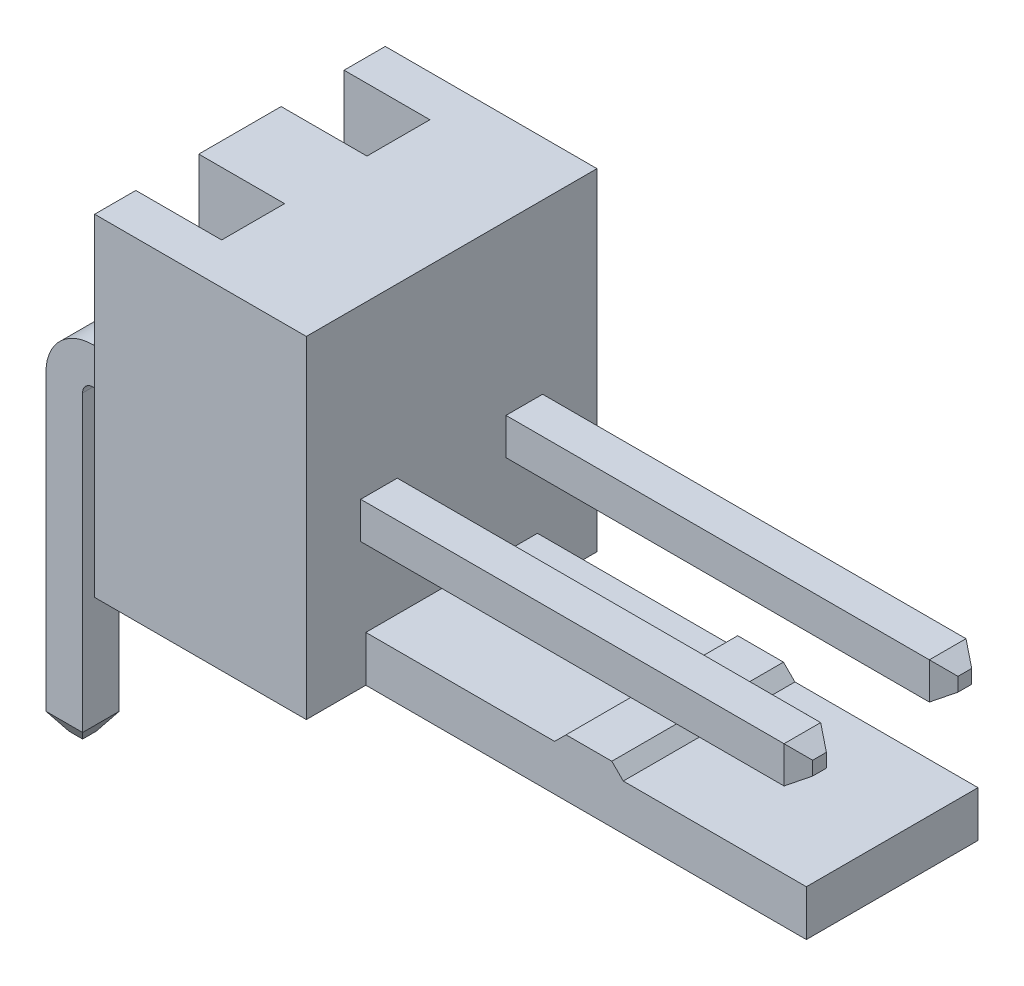
from build123d import *
from OCP.BRepFilletAPI import BRepFilletAPI_MakeChamfer

# Parameters (mm, degrees)
SKETCH_1_W                           = 5.08
SKETCH_1_H                           = 5.8
EXTRUDE_1_DEPTH                      = 3.7
CUT_EXTRUDE_1_REACH                  = 9.334
SKETCH_5_W                           = 1.5
SKETCH_5_H                           = 1.1
EXTRUDE_START                        = 1.27
EXTRUDE_1_2_DEPTH                    = 0.32
CHAMFER_1_SIZE                       = 0.2
CHAMFER_1_SIZE2                      = 0.3
CHAMFER_2_SIZE                       = 0.3
CHAMFER_2_SIZE_2                     = 0.2
EXTRUDE_2_DEPTH                      = 1.5
PATTERN_LINEAR_2_COUNT               = 2
PATTERN_LINEAR_2_PITCH               = 2.54
CHAMFER_1_OF_PATTERN_LINEAR_2_SIZE2  = 0.2
CHAMFER_1_OF_PATTERN_LINEAR_2_SIZE   = 0.3
CHAMFER_2_OF_PATTERN_LINEAR_2_SIZE   = 0.3
CHAMFER_2_OF_PATTERN_LINEAR_2_SIZE_2 = 0.2


with BuildPart() as part:
    # Эскиз1 → Extrude 1 (new body)
    with BuildSketch(Plane(origin=(0, 0, 0), x_dir=(0, 0, -1), z_dir=(1, 0, 0))):
        with Locations((0, 2.9)):
            Rectangle(SKETCH_1_W, SKETCH_1_H)
    extrude(amount=EXTRUDE_1_DEPTH)

    # Эскиз5 → Вырез-Вытянуть1 (cut, up to next)
    with BuildSketch(Plane(origin=(0, 5.8, 0), x_dir=(1, 0, 0), z_dir=(0, 1, 0)), mode=Mode.PRIVATE) as cut_extrude_1_sk1:
        with Locations((0.75, -1.27)):
            Rectangle(SKETCH_5_W, SKETCH_5_H)
    cut_extrude_1_tool1 = extrude(cut_extrude_1_sk1.sketch, amount=-CUT_EXTRUDE_1_REACH, mode=Mode.PRIVATE) & part.part
    cut_extrude_1 = cut_extrude_1_tool1.solids().sort_by_distance((0.75, 5.8, 1.27))[0]
    add(cut_extrude_1, mode=Mode.SUBTRACT)

    # Эскиз3 → Extrude 1 2 (add, symmetric)
    with BuildSketch(Plane.XY.offset(EXTRUDE_START)):
        with BuildLine():
            Line((-1.16, -3.4), (-1.16, 2.04))
            ThreePointArc((-1.16, 2.04), (-1.107279221, 2.167279221), (-0.98, 2.22))
            Line((-0.98, 2.22), (11.4, 2.22))
            Line((11.4, 2.22), (11.4, 2.86))
            Line((11.4, 2.86), (-0.98, 2.86))
            ThreePointArc((-0.98, 2.86), (-1.559827561, 2.619827561), (-1.8, 2.04))
            Line((-1.8, 2.04), (-1.8, -3.4))
            Line((-1.8, -3.4), (-1.16, -3.4))
        make_face()
    extrude_1_2 = extrude(amount=EXTRUDE_1_2_DEPTH, both=True)

    # Фаска1
    chamfer_1_edges = [part.edges().sort_by_distance(p)[0] for p in [
        (11.4, 2.54, 1.59),
        (11.4, 2.22, 1.27),
        (11.4, 2.86, 1.27),
        (11.4, 2.54, 0.95),
    ]]
    chamfer_1_side = [part.faces().sort_by_distance(p)[0] for p in [
        (11.4, 2.54, 1.27),
    ]]
    chamfer(chamfer_1_edges, length=CHAMFER_1_SIZE, length2=CHAMFER_1_SIZE2, reference=chamfer_1_side[0])

    # Фаска2
    chamfer_2_edges_1 = [part.edges().sort_by_distance(p)[0] for p in [
        (-1.48, -3.4, 0.95),
    ]]
    chamfer_2_side_1 = [part.faces().sort_by_distance(p)[0] for p in [
        (-1.48, -3.396, 0.95),
    ]]
    chamfer_2_edges_2 = [part.edges().sort_by_distance(p)[0] for p in [
        (-1.48, -3.4, 1.59),
    ]]
    chamfer_2_side_2 = [part.faces().sort_by_distance(p)[0] for p in [
        (-1.48, -3.396, 1.59),
    ]]
    chamfer_2_edges_3 = [part.edges().sort_by_distance(p)[0] for p in [
        (-1.8, -3.4, 1.27),
    ]]
    chamfer_2_side_3 = [part.faces().sort_by_distance(p)[0] for p in [
        (-1.796, -3.4, 1.27),
    ]]
    chamfer_2_edges_4 = [part.edges().sort_by_distance(p)[0] for p in [
        (-1.16, -3.4, 1.27),
    ]]
    chamfer_2_side_4 = [part.faces().sort_by_distance(p)[0] for p in [
        (-1.16, -3.396, 1.27),
    ]]
    chamfer_2 = BRepFilletAPI_MakeChamfer(part.part.solid().wrapped)
    for e in chamfer_2_edges_1:
        chamfer_2.Add(CHAMFER_2_SIZE - 0.0001, CHAMFER_2_SIZE_2 - 0.0001, e.wrapped, chamfer_2_side_1[0].wrapped)
    for e in chamfer_2_edges_2:
        chamfer_2.Add(CHAMFER_2_SIZE - 0.0001, CHAMFER_2_SIZE_2 - 0.0001, e.wrapped, chamfer_2_side_2[0].wrapped)
    for e in chamfer_2_edges_3:
        chamfer_2.Add(CHAMFER_2_SIZE_2 - 0.0001, CHAMFER_2_SIZE - 0.0001, e.wrapped, chamfer_2_side_3[0].wrapped)
    for e in chamfer_2_edges_4:
        chamfer_2.Add(CHAMFER_2_SIZE - 0.0001, CHAMFER_2_SIZE_2 - 0.0001, e.wrapped, chamfer_2_side_4[0].wrapped)
    add(Compound.cast(chamfer_2.Shape()), mode=Mode.REPLACE)  # a hair under: the kernel refuses the full size

    # Эскиз4 → Бобышка-Вытянуть2 (add, symmetric)
    with BuildSketch(Plane.XY):
        Polygon((3.7, 0), (3.7, 0.8), (7, 0.8), (7.2, 1), (8, 1), (8.2, 0.8), (11.4, 0.8), (11.4, 0), align=None)
    extrude(amount=EXTRUDE_2_DEPTH, both=True)

    # Линейный массив2: Вырез-Вытянуть1, Extrude 1 2 ×2
    with Locations(*[(0, 0, -i * PATTERN_LINEAR_2_PITCH) for i in range(1, PATTERN_LINEAR_2_COUNT)]):
        add(cut_extrude_1, mode=Mode.SUBTRACT)
        add(extrude_1_2)

    # Фаска1 of Линейный массив2
    chamfer_1_of_pattern_linear_2_edges = [part.edges().sort_by_distance(p)[0] for p in [
        (11.4, 2.54, -0.95),
        (11.4, 2.22, -1.27),
        (11.4, 2.86, -1.27),
        (11.4, 2.54, -1.59),
    ]]
    chamfer(chamfer_1_of_pattern_linear_2_edges, length=CHAMFER_1_OF_PATTERN_LINEAR_2_SIZE, length2=CHAMFER_1_OF_PATTERN_LINEAR_2_SIZE2)

    # Фаска2 of Линейный массив2
    chamfer_2_of_pattern_linear_2_edges_1 = [part.edges().sort_by_distance(p)[0] for p in [
        (-1.48, -3.4, -1.59),
    ]]
    chamfer_2_of_pattern_linear_2_side_1 = [part.faces().sort_by_distance(p)[0] for p in [
        (-1.48, -3.396, -1.59),
    ]]
    chamfer_2_of_pattern_linear_2_edges_2 = [part.edges().sort_by_distance(p)[0] for p in [
        (-1.48, -3.4, -0.95),
    ]]
    chamfer_2_of_pattern_linear_2_side_2 = [part.faces().sort_by_distance(p)[0] for p in [
        (-1.48, -3.396, -0.95),
    ]]
    chamfer_2_of_pattern_linear_2_edges_3 = [part.edges().sort_by_distance(p)[0] for p in [
        (-1.8, -3.4, -1.27),
    ]]
    chamfer_2_of_pattern_linear_2_side_3 = [part.faces().sort_by_distance(p)[0] for p in [
        (-1.796, -3.4, -1.27),
    ]]
    chamfer_2_of_pattern_linear_2_edges_4 = [part.edges().sort_by_distance(p)[0] for p in [
        (-1.16, -3.4, -1.27),
    ]]
    chamfer_2_of_pattern_linear_2_side_4 = [part.faces().sort_by_distance(p)[0] for p in [
        (-1.16, -3.396, -1.27),
    ]]
    chamfer_2_of_pattern_linear_2 = BRepFilletAPI_MakeChamfer(part.part.solid().wrapped)
    for e in chamfer_2_of_pattern_linear_2_edges_1:
        chamfer_2_of_pattern_linear_2.Add(CHAMFER_2_OF_PATTERN_LINEAR_2_SIZE - 0.0001, CHAMFER_2_OF_PATTERN_LINEAR_2_SIZE_2 - 0.0001, e.wrapped, chamfer_2_of_pattern_linear_2_side_1[0].wrapped)
    for e in chamfer_2_of_pattern_linear_2_edges_2:
        chamfer_2_of_pattern_linear_2.Add(CHAMFER_2_OF_PATTERN_LINEAR_2_SIZE - 0.0001, CHAMFER_2_OF_PATTERN_LINEAR_2_SIZE_2 - 0.0001, e.wrapped, chamfer_2_of_pattern_linear_2_side_2[0].wrapped)
    for e in chamfer_2_of_pattern_linear_2_edges_3:
        chamfer_2_of_pattern_linear_2.Add(CHAMFER_2_OF_PATTERN_LINEAR_2_SIZE_2 - 0.0001, CHAMFER_2_OF_PATTERN_LINEAR_2_SIZE - 0.0001, e.wrapped, chamfer_2_of_pattern_linear_2_side_3[0].wrapped)
    for e in chamfer_2_of_pattern_linear_2_edges_4:
        chamfer_2_of_pattern_linear_2.Add(CHAMFER_2_OF_PATTERN_LINEAR_2_SIZE - 0.0001, CHAMFER_2_OF_PATTERN_LINEAR_2_SIZE_2 - 0.0001, e.wrapped, chamfer_2_of_pattern_linear_2_side_4[0].wrapped)
    add(Compound.cast(chamfer_2_of_pattern_linear_2.Shape()), mode=Mode.REPLACE)  # a hair under: the kernel refuses the full size


solid = part.part
